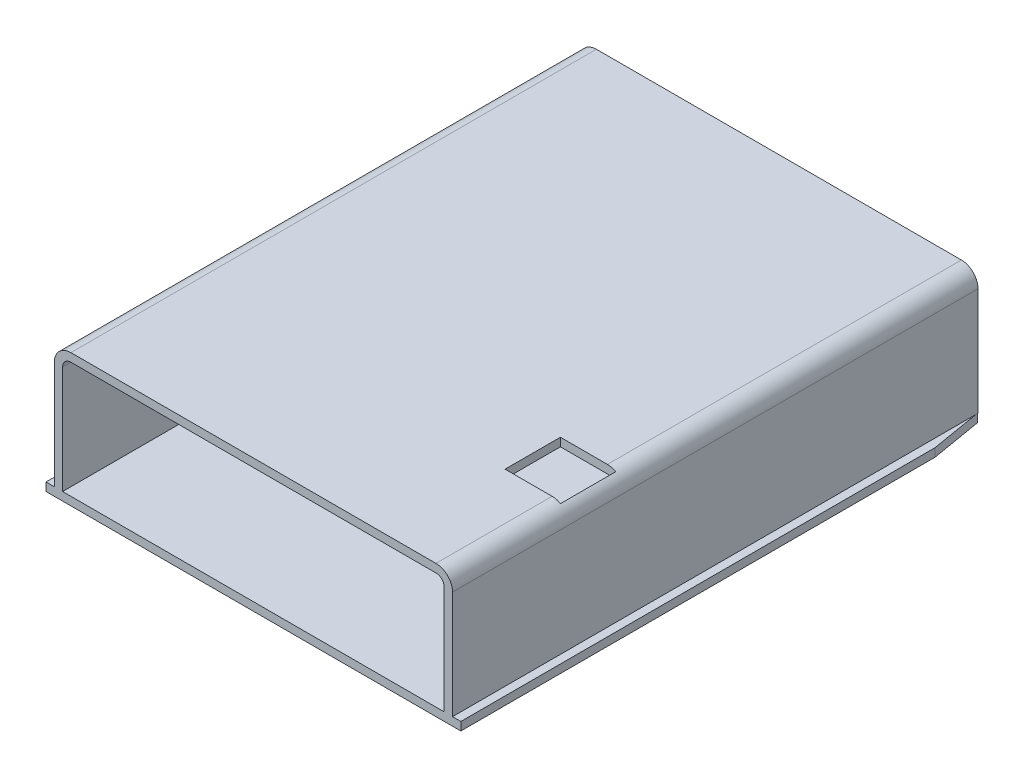
from build123d import *

# Parameters (mm, degrees)
SKETCH1_W           = 72
SKETCH1_H           = 24
BOSS_EXTRUDE1_DEPTH = 95
SKETCH2_W           = 69
SKETCH2_H           = 21
CUT_EXTRUDE1_DEPTH  = 93
SKETCH3_W           = 10
SKETCH3_H           = 10
CUT_EXTRUDE2_DEPTH  = 2
SKETCH4_W           = 27.74
SKETCH4_H           = 5
BOSS_EXTRUDE2_DEPTH = 14
SKETCH5_W           = 25.74
SKETCH5_H           = 3
CUT_EXTRUDE3_DEPTH  = 16
SKETCH6_W           = 1.5
SKETCH6_H           = 1.5
BOSS_EXTRUDE4_DEPTH = 95
FILLET1_R           = 3
BOSS_EXTRUDE5_DEPTH = 1
FILLET2_R           = 1.5
CUT_EXTRUDE4_DEPTH  = 1.5


with BuildPart() as part:
    # Sketch1 → Boss-Extrude1 (new body)
    with BuildSketch(Plane.XY):
        with Locations((36, 12)):
            Rectangle(SKETCH1_W, SKETCH1_H)
    extrude(amount=BOSS_EXTRUDE1_DEPTH)

    # Sketch2 → Cut-Extrude1 (cut)
    with BuildSketch(Plane.XY.offset(95)):
        with Locations((36, 12)):
            Rectangle(SKETCH2_W, SKETCH2_H)
    extrude(amount=-CUT_EXTRUDE1_DEPTH, mode=Mode.SUBTRACT)

    # Sketch3 → Cut-Extrude2 (cut)
    with BuildSketch(Plane(origin=(0, 24, 0), x_dir=(1, 0, 0), z_dir=(0, 1, 0))):
        with Locations((65.5, -69)):
            Rectangle(SKETCH3_W, SKETCH3_H)
    extrude(amount=-CUT_EXTRUDE2_DEPTH, mode=Mode.SUBTRACT)

    # Sketch4 → Boss-Extrude2 (add)
    with BuildSketch(Plane.XY.offset(2)):
        with Locations((15.37, 20)):
            Rectangle(SKETCH4_W, SKETCH4_H)
    extrude(amount=BOSS_EXTRUDE2_DEPTH)

    # Sketch5 → Cut-Extrude3 (cut)
    with BuildSketch(Plane(origin=(0, 0, 0), x_dir=(-1, 0, 0), z_dir=(0, 0, -1))):
        with Locations((-14.37, 21)):
            Rectangle(SKETCH5_W, SKETCH5_H)
    extrude(amount=-CUT_EXTRUDE3_DEPTH, mode=Mode.SUBTRACT)

    # Sketch6 → Boss-Extrude4 (add)
    with BuildSketch(Plane(origin=(0, 0, 0), x_dir=(-1, 0, 0), z_dir=(0, 0, -1))):
        with Locations((-72.75, 0.75)):
            Rectangle(SKETCH6_W, SKETCH6_H)
        with Locations((0.75, 0.75)):
            Rectangle(SKETCH6_W, SKETCH6_H)
    extrude(amount=-BOSS_EXTRUDE4_DEPTH)

    # Fillet1
    # the kernel refuses this fillet: 3 mm, written as the material it takes off along each edge
    with BuildSketch(Plane(origin=(0, 24, -7.5), x_dir=(1, 0, 0), z_dir=(0, 0, 1)), Plane(origin=(72, 24, -7.5), x_dir=(0, -1, 0), z_dir=(0, 0, 1))) as fillet1_piece_1:
        with BuildLine():
            CenterArc((FILLET1_R, -FILLET1_R), FILLET1_R, 90, 90)
            Line((0, -FILLET1_R), (0, 0))
            Line((0, 0), (FILLET1_R, 0))
        make_face()
    extrude(amount=110, mode=Mode.SUBTRACT)

    # Sketch7 → Boss-Extrude5 (add)
    with BuildSketch(Plane.XY.offset(16)):
        Polygon((29.24, 22.5), (26.24, 22.5), (26.24, 19.5), (3.1, 19.5), (3.1, 22.5), (1.5, 22.5), (1.5, 17.5), (3.1, 17.5), (26.24, 17.5), (29.24, 17.5), align=None)
    extrude(amount=BOSS_EXTRUDE5_DEPTH)

    # Fillet2
    fillet2_edges = [part.edges().sort_by_distance(p)[0] for p in [
        (1.5, 22.5, 56),
        (70.5, 22.5, 33),
        (70.5, 22.5, 84.5),
    ]]
    fillet(fillet2_edges, radius=FILLET2_R)

    # Sketch8 → Cut-Extrude4 (cut)
    with BuildSketch(Plane(origin=(0, 0, 0), x_dir=(-1, 0, 0), z_dir=(0, -1, 0))):
        Polygon((0, 0), (1.5, -9.268975532), (1.5, 0), align=None)
        Polygon((-73.5, -9.268975532), (-71.934797197, 0), (-73.5, 0), align=None)
    extrude(amount=-CUT_EXTRUDE4_DEPTH, mode=Mode.SUBTRACT)


solid = part.part
